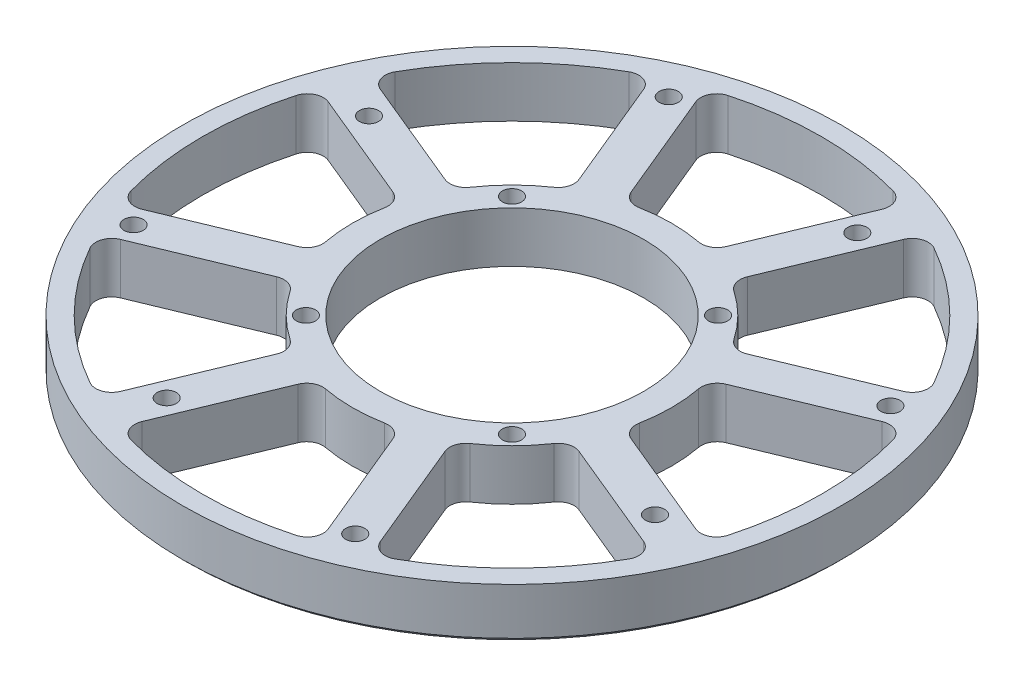
from build123d import *

# Parameters (mm, degrees)
SKETCH2_W                   = 82.55
SKETCH2_H                   = 12.7
F_12_0_189_DIAMETER_HOLE1_D = 4.8006
CIRPATTERN3_COUNT           = 4
CUT_EXTRUDE1_DEPTH          = 118.432086757
FILLET1_R                   = 4
CIRPATTERN4_COUNT           = 8
FILLET1_OF_CIRPATTERN4_R    = 4
CHAMFER2_SIZE               = 1
SKETCH9_R                   = 33
CUT_EXTRUDE2_DEPTH          = 118.432086757


with BuildPart() as part:
    # Sketch2 → Revolve1 (revolve)
    with BuildSketch(Plane(origin=(0, 0, 0), x_dir=(0, 0, -1), z_dir=(1, 0, 0))):
        with Locations((-41.275, 6.35)):
            Rectangle(SKETCH2_W, SKETCH2_H)
    revolve(axis=Axis((0, -0.635, 0), (0, 1, 0)))

    # #12 (0.189) Diameter Hole1 (through all)
    with Locations(Plane(origin=(0, 12.7, 0), x_dir=(1, 0, 0), z_dir=(0, 1, 0))):
        with Locations((-27.763683018, 67.027460084), (-61.160825052, 25.333643223), (-25.809397513, 25.809397513)):
            f_12_0_189_diameter_hole1 = Hole(F_12_0_189_DIAMETER_HOLE1_D / 2)

    # CirPattern3: #12 (0.189) Diameter Hole1 ×4 about axis
    cirpattern3_axis = Axis((0, -0.635, 0), (0, 1, 0))
    for i in range(1, CIRPATTERN3_COUNT):
        add(f_12_0_189_diameter_hole1.rotate(cirpattern3_axis, i * 360 / CIRPATTERN3_COUNT), mode=Mode.SUBTRACT)

    # Sketch8 → Cut-Extrude1 (cut, through all)
    with BuildSketch(Plane(origin=(0, 12.7, 0), x_dir=(1, 0, 0), z_dir=(0, 1, 0))):
        with BuildLine():
            Line((-10.567880231, 38.578749428), (-24.995954941, 73.411203073))
            ThreePointArc((-24.995954941, 73.411203073), (0, 77.55), (24.995954941, 73.411203073))
            Line((24.995954941, 73.411203073), (10.567880231, 38.578749428))
            ThreePointArc((10.567880231, 38.578749428), (0, 40), (-10.567880231, 38.578749428))
        make_face()
    cut_extrude1 = extrude(amount=-CUT_EXTRUDE1_DEPTH, mode=Mode.SUBTRACT)

    # Fillet1
    fillet1_edges = [part.edges().sort_by_distance(p)[0] for p in [
        (10.567880231, 6.35, -38.578749428),
        (24.995954941, 6.35, -73.411203073),
        (-10.567880231, 6.35, -38.578749428),
        (-24.995954941, 6.35, -73.411203073),
    ]]
    fillet(fillet1_edges, radius=FILLET1_R)

    # CirPattern4: Cut-Extrude1 ×8 about axis
    cirpattern4_axis = Axis((0, -0.635, 0), (0, 1, 0))
    for i in range(1, CIRPATTERN4_COUNT):
        add(cut_extrude1.rotate(cirpattern4_axis, i * 360 / CIRPATTERN4_COUNT), mode=Mode.SUBTRACT)

    # Fillet1 of CirPattern4
    fillet1_of_cirpattern4_edges = [part.edges().sort_by_distance(p)[0] for p in [
        (-19.806675556, 6.35, -34.751915104),
        (-34.234750266, 6.35, -69.584368749),
        (-34.751915104, 6.35, -19.806675556),
        (-69.584368749, 6.35, -34.234750266),
        (-38.578749428, 6.35, -10.567880231),
        (-73.411203073, 6.35, -24.995954941),
        (-38.578749428, 6.35, 10.567880231),
        (-73.411203073, 6.35, 24.995954941),
        (-34.751915104, 6.35, 19.806675556),
        (-69.584368749, 6.35, 34.234750266),
        (-19.806675556, 6.35, 34.751915104),
        (-34.234750266, 6.35, 69.584368749),
        (-10.567880231, 6.35, 38.578749428),
        (-24.995954941, 6.35, 73.411203073),
        (10.567880231, 6.35, 38.578749428),
        (24.995954941, 6.35, 73.411203073),
        (19.806675556, 6.35, 34.751915104),
        (34.234750266, 6.35, 69.584368749),
        (34.751915104, 6.35, 19.806675556),
        (69.584368749, 6.35, 34.234750266),
        (38.578749428, 6.35, 10.567880231),
        (73.411203073, 6.35, 24.995954941),
        (38.578749428, 6.35, -10.567880231),
        (73.411203073, 6.35, -24.995954941),
        (34.751915104, 6.35, -19.806675556),
        (69.584368749, 6.35, -34.234750266),
        (19.806675556, 6.35, -34.751915104),
        (34.234750266, 6.35, -69.584368749),
    ]]
    fillet(fillet1_of_cirpattern4_edges, radius=FILLET1_OF_CIRPATTERN4_R)

    # Chamfer2
    chamfer2_edges = [part.edges().sort_by_distance(p)[0] for p in [
        (0, 0, -82.55),
    ]]
    chamfer(chamfer2_edges, length=CHAMFER2_SIZE)

    # Sketch9 → Cut-Extrude2 (cut, through all)
    with BuildSketch(Plane(origin=(0, 12.7, 0), x_dir=(1, 0, 0), z_dir=(0, 1, 0))):
        Circle(SKETCH9_R)
    extrude(amount=-CUT_EXTRUDE2_DEPTH, mode=Mode.SUBTRACT)


solid = part.part
